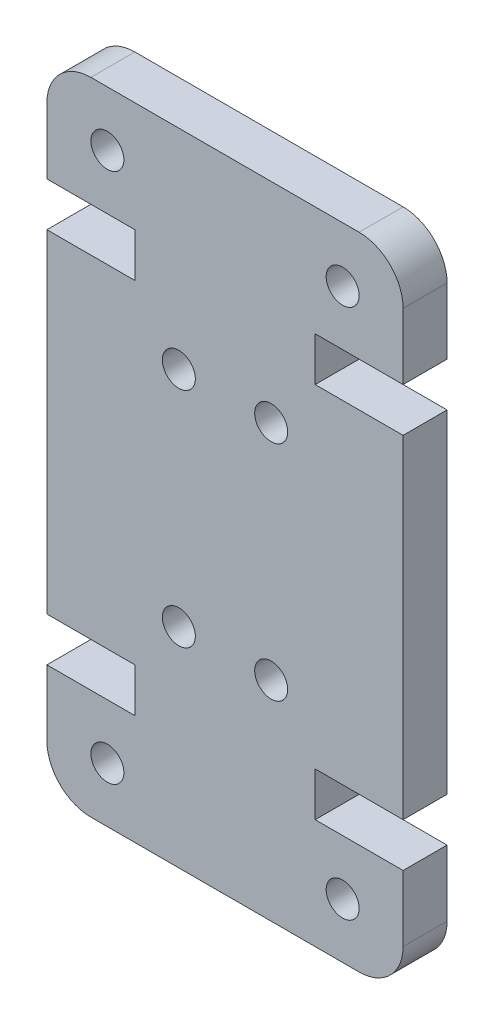
from build123d import *

# Parameters (mm, degrees)
SKETCH1_R           = 0.75
BOSS_EXTRUDE1_DEPTH = 2


with BuildPart() as part:
    # Sketch1 → Boss-Extrude1 (new body)
    with BuildSketch(Plane.XY):
        with BuildLine():
            Line((0, 22.14), (0, 7))
            Line((0, 7), (4, 7))
            Line((4, 7), (4, 5))
            Line((4, 5), (0, 5))
            Line((0, 5), (0, 2))
            ThreePointArc((0, 2), (0.585786438, 0.585786438), (2, 0))
            Line((2, 0), (14.2, 0))
            ThreePointArc((14.2, 0), (15.614213562, 0.585786438), (16.2, 2))
            Line((16.2, 2), (16.2, 5))
            Line((16.2, 5), (12.2, 5))
            Line((12.2, 5), (12.2, 7))
            Line((12.2, 7), (16.2, 7))
            Line((16.2, 7), (16.2, 22.14))
            Line((16.2, 22.14), (12.2, 22.14))
            Line((12.2, 22.14), (12.2, 24.14))
            Line((12.2, 24.14), (16.2, 24.14))
            Line((16.2, 24.14), (16.2, 27.14))
            ThreePointArc((16.2, 27.14), (15.614213562, 28.554213562), (14.2, 29.14))
            Line((14.2, 29.14), (2, 29.14))
            ThreePointArc((2, 29.14), (0.585786438, 28.554213562), (0, 27.14))
            Line((0, 27.14), (0, 24.14))
            Line((0, 24.14), (4, 24.14))
            Line((4, 24.14), (4, 22.14))
            Line((4, 22.14), (0, 22.14))
        make_face()
        with Locations((10.2, 19.64)):
            Circle(SKETCH1_R, mode=Mode.SUBTRACT)
        with Locations((6, 19.64)):
            Circle(SKETCH1_R, mode=Mode.SUBTRACT)
        with Locations((10.2, 9.5)):
            Circle(SKETCH1_R, mode=Mode.SUBTRACT)
        with Locations((6, 9.5)):
            Circle(SKETCH1_R, mode=Mode.SUBTRACT)
        with Locations((13.45, 2.5)):
            Circle(SKETCH1_R, mode=Mode.SUBTRACT)
        with Locations((2.75, 2.5)):
            Circle(SKETCH1_R, mode=Mode.SUBTRACT)
        with Locations((13.45, 26.64)):
            Circle(SKETCH1_R, mode=Mode.SUBTRACT)
        with Locations((2.75, 26.64)):
            Circle(SKETCH1_R, mode=Mode.SUBTRACT)
    extrude(amount=BOSS_EXTRUDE1_DEPTH)


solid = part.part
